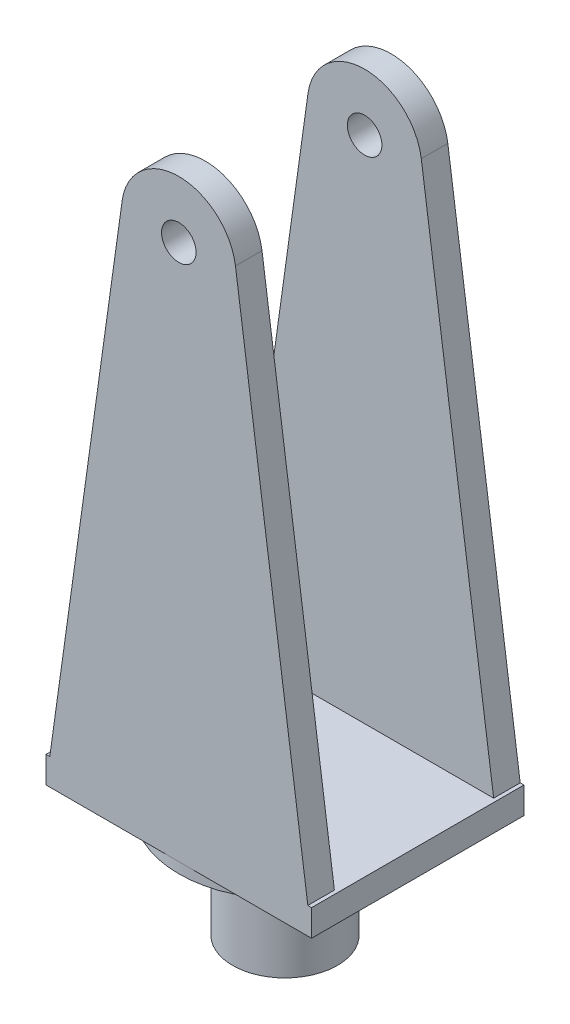
from build123d import *

# Parameters (mm, degrees)
SKETCH1_W           = 25
SKETCH1_H           = 20
BOSS_EXTRUDE1_DEPTH = 2.5
SKETCH4_R           = 10
BOSS_EXTRUDE3_DEPTH = 1
SKETCH5_R           = 4.9365
BOSS_EXTRUDE4_DEPTH = 10
SKETCH6_R           = 1.627
BOSS_EXTRUDE5_DEPTH = 2.5


with BuildPart() as part:
    # Sketch1 → Boss-Extrude1 (new body)
    with BuildSketch(Plane(origin=(0, 0, 0), x_dir=(1, 0, 0), z_dir=(0, 1, 0))):
        Rectangle(SKETCH1_W, SKETCH1_H)
    extrude(amount=BOSS_EXTRUDE1_DEPTH)

    # Sketch4 → Boss-Extrude3 (add)
    with BuildSketch(Plane.XZ):
        Circle(SKETCH4_R)
    extrude(amount=BOSS_EXTRUDE3_DEPTH)

    # Sketch5 → Boss-Extrude4 (add)
    with BuildSketch(Plane.XZ.offset(1)):
        Circle(SKETCH5_R)
    extrude(amount=BOSS_EXTRUDE4_DEPTH)

    # Sketch6 → Boss-Extrude5 (add)
    with BuildSketch(Plane(origin=(0, 0, -10), x_dir=(-1, 0, 0), z_dir=(0, 0, -1))):
        with BuildLine():
            Line((-12.150452519, 2.5), (12.150452519, 2.5))
            Line((12.150452519, 2.5), (5.334920531, 51.245394823))
            ThreePointArc((5.334920531, 51.245394823), (0, 55.886742106), (-5.334920531, 51.245394823))
            Line((-5.334920531, 51.245394823), (-12.150452519, 2.5))
        make_face()
        with Locations((0, 50.5)):
            Circle(SKETCH6_R, mode=Mode.SUBTRACT)
    boss_extrude5 = extrude(amount=-BOSS_EXTRUDE5_DEPTH)

    # Mirror2: Boss-Extrude5 across plane
    add(boss_extrude5.mirror(Plane(origin=(0, 0, 0), x_dir=(1, 0, 0), z_dir=(0, 0, -1))))


solid = part.part
